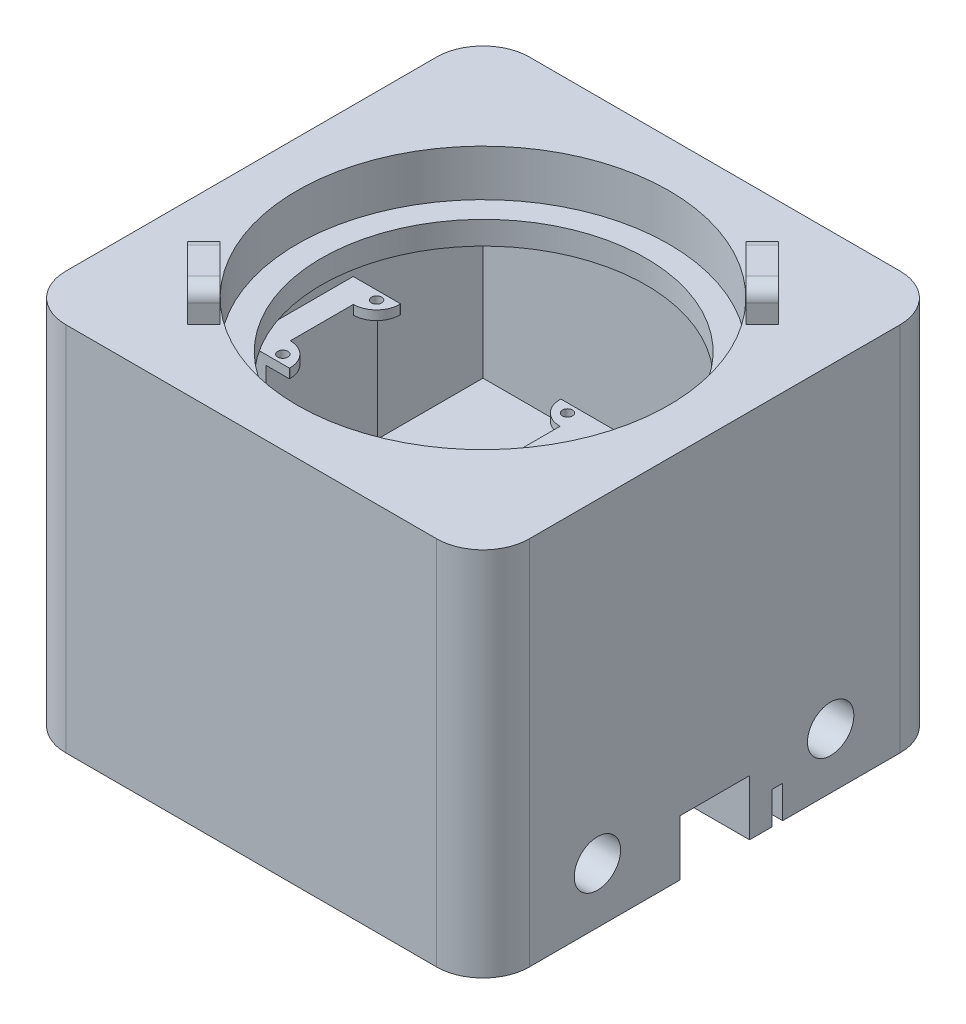
from build123d import *

# Parameters (mm, degrees)
SKETCH1_W            = 100
SKETCH1_H            = 100
BOSS_EXTRUDE1_DEPTH  = 25
SKETCH2_W            = 100
SKETCH2_H            = 100
SKETCH2_W_2          = 80
SKETCH2_H_2          = 80
BOSS_EXTRUDE2_DEPTH  = 40
SKETCH3_R            = 5
SKETCH3_W            = 15
SKETCH3_H            = 12
CUT_EXTRUDE1_DEPTH   = 130.325171564
FILLET2_R            = 10
FILLET3_R            = 10
FILLET4_R            = 10
FILLET5_R            = 10
BOSS_EXTRUDE3_DEPTH  = 15
SKETCH6_R            = 35
CUT_EXTRUDE3_DEPTH   = 25
SKETCH7_R            = 40.1
CUT_EXTRUDE4_DEPTH   = 10
BOSS_EXTRUDE4_DEPTH  = 12
SKETCH10_R           = 1.1
SKETCH10_W           = 5
SKETCH10_H           = 13.6
CUT_EXTRUDE5_DEPTH   = 10
FILLET6_R            = 5
SKETCH11_W           = 12
SKETCH11_H           = 0.5
CUT_EXTRUDE6_DEPTH   = 24
SKETCH12_W           = 10
SKETCH12_H           = 15
CUT_EXTRUDE7_DEPTH   = 24
SKETCH15_W           = 10
SKETCH15_H           = 2.75
BOSS_EXTRUDE5_DEPTH  = 5.4
SKETCH18_R           = 2.5
CUT_EXTRUDE8_DEPTH   = 7
BOSS_EXTRUDE6_DEPTH  = 5
FILLET8_R            = 3
FILLET8_OF_MIRROR3_R = 3


with BuildPart() as part:
    # Sketch1 → Boss-Extrude1 (new body)
    with BuildSketch(Plane(origin=(0, 0, 0), x_dir=(1, 0, 0), z_dir=(0, 1, 0))):
        Rectangle(SKETCH1_W, SKETCH1_H)
    extrude(amount=BOSS_EXTRUDE1_DEPTH)

    # Sketch2 → Boss-Extrude2 (add)
    with BuildSketch(Plane(origin=(0, 25, 0), x_dir=(1, 0, 0), z_dir=(0, 1, 0))):
        Rectangle(SKETCH2_W, SKETCH2_H)
        Rectangle(SKETCH2_W_2, SKETCH2_H_2, mode=Mode.SUBTRACT)
    extrude(amount=BOSS_EXTRUDE2_DEPTH)

    # Sketch3 → Cut-Extrude1 (cut, through all)
    with BuildSketch(Plane.ZY.offset(50)):
        with Locations((-25, 12)):
            Circle(SKETCH3_R)
        with Locations((25.313920598, 12)):
            Circle(SKETCH3_R)
        with Locations((0, 6)):
            Rectangle(SKETCH3_W, SKETCH3_H)
    extrude(amount=-CUT_EXTRUDE1_DEPTH, mode=Mode.SUBTRACT)

    # Fillet2
    fillet2_edges = [part.edges().sort_by_distance(p)[0] for p in [
        (50, 32.5, 50),
    ]]
    fillet(fillet2_edges, radius=FILLET2_R)

    # Fillet3
    fillet3_edges = [part.edges().sort_by_distance(p)[0] for p in [
        (50, 32.5, -50),
    ]]
    fillet(fillet3_edges, radius=FILLET3_R)

    # Fillet4
    fillet4_edges = [part.edges().sort_by_distance(p)[0] for p in [
        (-50, 32.5, -50),
    ]]
    fillet(fillet4_edges, radius=FILLET4_R)

    # Fillet5
    fillet5_edges = [part.edges().sort_by_distance(p)[0] for p in [
        (-50, 32.5, 50),
    ]]
    fillet(fillet5_edges, radius=FILLET5_R)

    # Sketch5 → Boss-Extrude3 (add)
    with BuildSketch(Plane(origin=(0, 65, 0), x_dir=(1, 0, 0), z_dir=(0, 1, 0))):
        with BuildLine():
            Line((-50, 40), (-50, -40))
            ThreePointArc((-50, -40), (-47.071067812, -47.071067812), (-40, -50))
            Line((-40, -50), (40, -50))
            ThreePointArc((40, -50), (47.071067812, -47.071067812), (50, -40))
            Line((50, -40), (50, 40))
            ThreePointArc((50, 40), (47.071067812, 47.071067812), (40, 50))
            Line((40, 50), (-40, 50))
            ThreePointArc((-40, 50), (-47.071067812, 47.071067812), (-50, 40))
        make_face()
    extrude(amount=BOSS_EXTRUDE3_DEPTH)

    # Sketch6 → Cut-Extrude3 (cut)
    with BuildSketch(Plane(origin=(0, 80, 0), x_dir=(1, 0, 0), z_dir=(0, 1, 0))):
        with Locations(Location((0.142992369, 0, 0), (0, 0, 270))):
            Circle(SKETCH6_R)
    extrude(amount=-CUT_EXTRUDE3_DEPTH, mode=Mode.SUBTRACT)

    # Sketch7 → Cut-Extrude4 (cut)
    with BuildSketch(Plane(origin=(0, 80, 0), x_dir=(1, 0, 0), z_dir=(0, 1, 0))):
        with Locations(Location((0, 0, 0), (0, 0, 270))):
            Circle(SKETCH7_R)
    extrude(amount=-CUT_EXTRUDE4_DEPTH, mode=Mode.SUBTRACT)

    # Sketch9 → Boss-Extrude4 (add, symmetric)
    with BuildSketch(Plane.XY):
        Polygon((9.8, 56), (9.8, 25), (16.8, 25), (16.8, 58), (4.8, 58), (4.8, 56), align=None)
    boss_extrude4 = extrude(amount=BOSS_EXTRUDE4_DEPTH, both=True)

    # Mirror1: Boss-Extrude4 across plane
    add(boss_extrude4.mirror(Plane.ZY.offset(12.485)))

    # Sketch10 → Cut-Extrude5 (cut)
    with BuildSketch(Plane(origin=(0, 58, 0), x_dir=(1, 0, 0), z_dir=(0, 1, 0))):
        with Locations(Location((8.1, -10.125, 0), (0, 0, 270))):
            Circle(SKETCH10_R)
        with Locations(Location((8.1, 10.125, 0), (0, 0, 270))):
            Circle(SKETCH10_R)
        with Locations((7.3, 0)):
            Rectangle(SKETCH10_W, SKETCH10_H)
    cut_extrude5 = extrude(amount=-CUT_EXTRUDE5_DEPTH, mode=Mode.SUBTRACT)

    # Mirror2: Cut-Extrude5 across plane
    add(cut_extrude5.mirror(Plane.ZY.offset(12.485)), mode=Mode.SUBTRACT)

    # Fillet6
    fillet6_edges = [part.edges().sort_by_distance(p)[0] for p in [
        (-29.77, 57, 6.8),
        (-29.77, 57, -6.8),
        (4.8, 57, 6.8),
        (4.8, 57, -6.8),
    ]]
    fillet(fillet6_edges, radius=FILLET6_R - 0.0001)  # a hair under: the kernel refuses the full size

    # Sketch11 → Cut-Extrude6 (cut)
    with BuildSketch(Plane.XY.offset(12)):
        with Locations((10.8, 57.75)):
            Rectangle(SKETCH11_W, SKETCH11_H)
    extrude(amount=-CUT_EXTRUDE6_DEPTH, mode=Mode.SUBTRACT)

    # Sketch12 → Cut-Extrude7 (cut)
    with BuildSketch(Plane(origin=(0, 25, 0), x_dir=(1, 0, 0), z_dir=(0, 1, 0))):
        with Locations((-12, 0)):
            Rectangle(SKETCH12_W, SKETCH12_H)
    extrude(amount=-CUT_EXTRUDE7_DEPTH, mode=Mode.SUBTRACT)

    # Sketch15 → Boss-Extrude5 (add)
    with BuildSketch(Plane(origin=(0, 25, 0), x_dir=(1, 0, 0), z_dir=(0, 1, 0))):
        with Locations((-12.485, -10.625)):
            Rectangle(SKETCH15_W, SKETCH15_H)
    extrude(amount=BOSS_EXTRUDE5_DEPTH)

    # Sketch18 → Cut-Extrude8 (cut)
    # profile 1 of 2: a face of its own
    with BuildSketch(Plane.XZ):
        with BuildLine():
            Line((-50, -12.35), (-50, -14.65))
            Line((-50, -14.65), (-41.831122551, -14.65))
            ThreePointArc((-41.831122551, -14.65), (-34, -13.5), (-41.831122551, -12.35))
            Line((-41.831122551, -12.35), (-50, -12.35))
        make_face()
        with Locations(Location((-38, -13.5, 0), (0, 0, 270))):
            Circle(SKETCH18_R, mode=Mode.SUBTRACT)
    # profile 2 of 2: a face of its own
    with BuildSketch(Plane.XZ):
        with BuildLine():
            Line((41.845776905, -14.65), (50, -14.65))
            Line((50, -14.65), (50, -12.35))
            Line((50, -12.35), (41.845776905, -12.35))
            ThreePointArc((41.845776905, -12.35), (33.985962133, -13.5), (41.845776905, -14.65))
        make_face()
        with Locations(Location((38, -13.5, 0), (0, 0, 90))):
            Circle(SKETCH18_R, mode=Mode.SUBTRACT)
    extrude(amount=-CUT_EXTRUDE8_DEPTH, mode=Mode.SUBTRACT)

    # Sketch20 → Boss-Extrude6 (add)
    with BuildSketch(Plane(origin=(-28.354981926, 0, 28.354981926), x_dir=(0.7071067811865476, 0, 0.7071067811865475), z_dir=(-0.7071067811865475, 0, 0.7071067811865476))):
        Polygon((-4.498932188, 80), (-4.498932188, 84), (4.501067812, 84), (4.501067812, 80), (7.071067812, 80), (7.071067812, 87), (-7.071067812, 87), (-7.071067812, 80), align=None)
    boss_extrude6 = extrude(amount=BOSS_EXTRUDE6_DEPTH)

    # Fillet8
    fillet8_edges = [part.edges().sort_by_distance(p)[0] for p in [
        (-35.122748879, 87, 25.122748879),
        (-25.122748879, 87, 35.122748879),
    ]]
    fillet(fillet8_edges, radius=FILLET8_R)

    # Mirror3: Boss-Extrude6 across plane
    add(boss_extrude6.mirror(Plane(origin=(0, 0, 0), x_dir=(0.7071067811865476, 0, 0.7071067811865475), z_dir=(-0.7071067811865475, 0, 0.7071067811865476))))

    # Fillet8 of Mirror3
    fillet8_of_mirror3_edges = [part.edges().sort_by_distance(p)[0] for p in [
        (25.122748879, 87, -35.122748879),
        (35.122748879, 87, -25.122748879),
    ]]
    fillet(fillet8_of_mirror3_edges, radius=FILLET8_OF_MIRROR3_R)


solid = part.part
